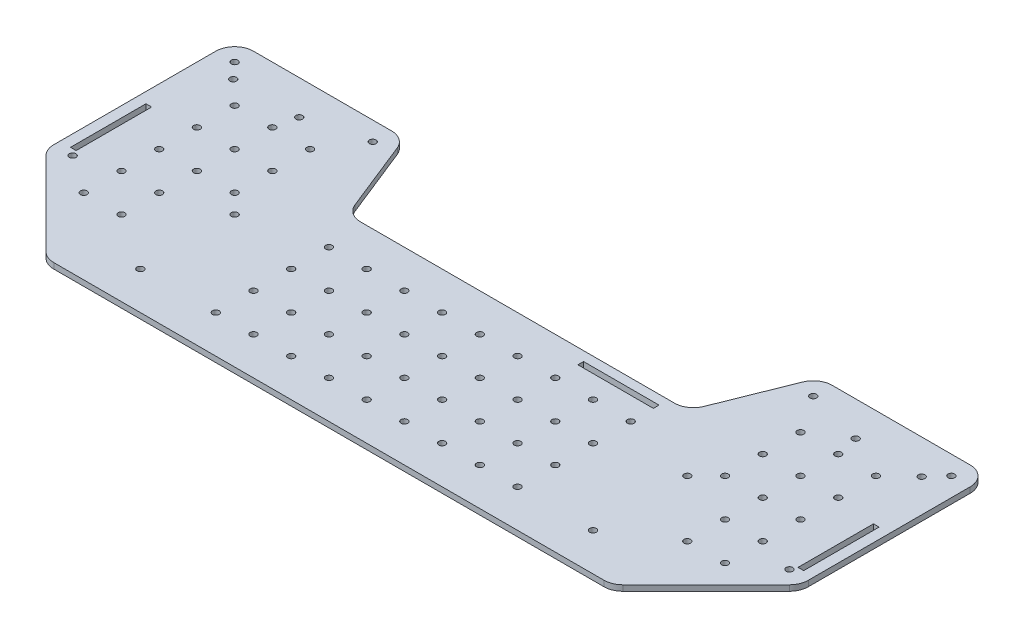
from build123d import *

# Parameters (mm, degrees)
EXTRUDE_1_DEPTH     = 3
SKETCH_2_R          = 1.75
CUT_EXTRUDE_1_DEPTH = 59
SKETCH_3_R          = 1.75
CUT_EXTRUDE_2_DEPTH = 59
SKETCH_5_R          = 1.75
CUT_EXTRUDE_4_DEPTH = 10
SKETCH_6_R          = 1.75
CUT_EXTRUDE_5_DEPTH = 10
SKETCH_7_R          = 1.75
CUT_EXTRUDE_6_DEPTH = 10
SKETCH_4_R          = 1.75
CUT_EXTRUDE_3_DEPTH = 59
SKETCH_8_W          = 3
SKETCH_8_H          = 40
CUT_EXTRUDE_7_DEPTH = 3
SKETCH_9_W          = 40
SKETCH_9_H          = 3
CUT_EXTRUDE_8_DEPTH = 4


with BuildPart() as part:
    # 草图1 → 凸台-拉伸1 (new body)
    with BuildSketch(Plane(origin=(0, 0, 0), x_dir=(1, 0, 0), z_dir=(0, 1, 0))):
        with BuildLine():
            Line((-197.071067812, -27.928932188), (-152.928932188, -72.071067812))
            ThreePointArc((-152.928932188, -72.071067812), (-149.6846987, -74.238795325), (-145.857864376, -75))
            Line((-145.857864376, -75), (145.857864376, -75))
            ThreePointArc((145.857864376, -75), (149.6846987, -74.238795325), (152.928932188, -72.071067812))
            Line((152.928932188, -72.071067812), (197.071067812, -27.928932188))
            ThreePointArc((197.071067812, -27.928932188), (199.238795325, -24.6846987), (200, -20.857864376))
            Line((200, -20.857864376), (200, 65))
            ThreePointArc((200, 65), (197.071067812, 72.071067812), (190, 75))
            Line((190, 75), (116.770329614, 75))
            ThreePointArc((116.770329614, 75), (111.164041521, 73.280672305), (107.485562705, 68.713906764))
            Line((107.485562705, 68.713906764), (92.514437295, 31.286093236))
            ThreePointArc((92.514437295, 31.286093236), (88.835958479, 26.719327695), (83.229670386, 25))
            Line((83.229670386, 25), (-83.229670386, 25))
            ThreePointArc((-83.229670386, 25), (-88.835958479, 26.719327695), (-92.514437295, 31.286093236))
            Line((-92.514437295, 31.286093236), (-107.485562705, 68.713906764))
            ThreePointArc((-107.485562705, 68.713906764), (-111.164041521, 73.280672305), (-116.770329614, 75))
            Line((-116.770329614, 75), (-190, 75))
            ThreePointArc((-190, 75), (-197.071067812, 72.071067812), (-200, 65))
            Line((-200, 65), (-200, -20.857864376))
            ThreePointArc((-200, -20.857864376), (-199.238795325, -24.6846987), (-197.071067812, -27.928932188))
        make_face()
    extrude(amount=EXTRUDE_1_DEPTH)

    # 草图2 → 切除-拉伸1 (cut)
    with BuildSketch(Plane.XZ):
        with Locations((120, 5)):
            Circle(SKETCH_2_R)
        with Locations((120, 55)):
            Circle(SKETCH_2_R)
        with Locations((-120, 55)):
            Circle(SKETCH_2_R)
        with Locations((-120, 5)):
            Circle(SKETCH_2_R)
    extrude(amount=-CUT_EXTRUDE_1_DEPTH, mode=Mode.SUBTRACT)

    # 草图3 → 切除-拉伸2 (cut)
    with BuildSketch(Plane(origin=(0, 3, 0), x_dir=(1, 0, 0), z_dir=(0, 1, 0))):
        with Locations((116.770329614, 65)):
            Circle(SKETCH_3_R)
        with Locations((190, 65)):
            Circle(SKETCH_3_R)
        with Locations((-190, 65)):
            Circle(SKETCH_3_R)
        with Locations((-116.770329614, 65)):
            Circle(SKETCH_3_R)
        with Locations((-190, -20.857864376)):
            Circle(SKETCH_3_R)
        with Locations((190, -20.857864376)):
            Circle(SKETCH_3_R)
    extrude(amount=-CUT_EXTRUDE_2_DEPTH, mode=Mode.SUBTRACT)

    # 草图5 → 切除-拉伸4 (cut)
    with BuildSketch(Plane(origin=(0, 3, 0), x_dir=(1, 0, 0), z_dir=(0, 1, 0))):
        with Locations((-20, 5)):
            Circle(SKETCH_5_R)
        with Locations((-20, -15)):
            Circle(SKETCH_5_R)
        with Locations((-20, -35)):
            Circle(SKETCH_5_R)
        with Locations((-20, -55)):
            Circle(SKETCH_5_R)
        with Locations((-40, 5)):
            Circle(SKETCH_5_R)
        with Locations((-40, -15)):
            Circle(SKETCH_5_R)
        with Locations((-40, -35)):
            Circle(SKETCH_5_R)
        with Locations((-40, -55)):
            Circle(SKETCH_5_R)
        with Locations((-60, 5)):
            Circle(SKETCH_5_R)
        with Locations((-60, -15)):
            Circle(SKETCH_5_R)
        with Locations((-60, -35)):
            Circle(SKETCH_5_R)
        with Locations((-60, -55)):
            Circle(SKETCH_5_R)
        with Locations((-80, 5)):
            Circle(SKETCH_5_R)
        with Locations((-80, -15)):
            Circle(SKETCH_5_R)
        with Locations((-80, -35)):
            Circle(SKETCH_5_R)
        with Locations((-80, -55)):
            Circle(SKETCH_5_R)
        with Locations((80, -55)):
            Circle(SKETCH_5_R)
        with Locations((80, -35)):
            Circle(SKETCH_5_R)
        with Locations((80, -15)):
            Circle(SKETCH_5_R)
        with Locations((80, 5)):
            Circle(SKETCH_5_R)
        with Locations((60, -55)):
            Circle(SKETCH_5_R)
        with Locations((60, -35)):
            Circle(SKETCH_5_R)
        with Locations((60, -15)):
            Circle(SKETCH_5_R)
        with Locations((60, 5)):
            Circle(SKETCH_5_R)
        with Locations((40, -55)):
            Circle(SKETCH_5_R)
        with Locations((40, -35)):
            Circle(SKETCH_5_R)
        with Locations((40, -15)):
            Circle(SKETCH_5_R)
        with Locations((40, 5)):
            Circle(SKETCH_5_R)
        with Locations((20, -55)):
            Circle(SKETCH_5_R)
        with Locations((20, -35)):
            Circle(SKETCH_5_R)
        with Locations((20, -15)):
            Circle(SKETCH_5_R)
        with Locations((20, 5)):
            Circle(SKETCH_5_R)
    extrude(amount=-CUT_EXTRUDE_4_DEPTH, mode=Mode.SUBTRACT)

    # 草图6 → 切除-拉伸5 (cut)
    with BuildSketch(Plane(origin=(0, 3, 0), x_dir=(1, 0, 0), z_dir=(0, 1, 0))):
        with Locations((-170, 45)):
            Circle(SKETCH_6_R)
        with Locations((-150, 45)):
            Circle(SKETCH_6_R)
        with Locations((-130, 45)):
            Circle(SKETCH_6_R)
        with Locations((-170, 25)):
            Circle(SKETCH_6_R)
        with Locations((-150, 25)):
            Circle(SKETCH_6_R)
        with Locations((-130, 25)):
            Circle(SKETCH_6_R)
        with Locations((-170, 5)):
            Circle(SKETCH_6_R)
        with Locations((-150, 5)):
            Circle(SKETCH_6_R)
        with Locations((-130, 5)):
            Circle(SKETCH_6_R)
        with Locations((-170, -15)):
            Circle(SKETCH_6_R)
        with Locations((-150, -15)):
            Circle(SKETCH_6_R)
        with Locations((-170, -35)):
            Circle(SKETCH_6_R)
        with Locations((-150, -35)):
            Circle(SKETCH_6_R)
        with Locations((150, -35)):
            Circle(SKETCH_6_R)
        with Locations((170, -35)):
            Circle(SKETCH_6_R)
        with Locations((150, -15)):
            Circle(SKETCH_6_R)
        with Locations((170, -15)):
            Circle(SKETCH_6_R)
        with Locations((130, 5)):
            Circle(SKETCH_6_R)
        with Locations((150, 5)):
            Circle(SKETCH_6_R)
        with Locations((170, 5)):
            Circle(SKETCH_6_R)
        with Locations((130, 25)):
            Circle(SKETCH_6_R)
        with Locations((150, 25)):
            Circle(SKETCH_6_R)
        with Locations((170, 25)):
            Circle(SKETCH_6_R)
        with Locations((130, 45)):
            Circle(SKETCH_6_R)
        with Locations((150, 45)):
            Circle(SKETCH_6_R)
        with Locations((170, 45)):
            Circle(SKETCH_6_R)
    extrude(amount=-CUT_EXTRUDE_5_DEPTH, mode=Mode.SUBTRACT)

    # 草图7 → 切除-拉伸6 (cut)
    with BuildSketch(Plane(origin=(0, 3, 0), x_dir=(1, 0, 0), z_dir=(0, 1, 0))):
        with Locations((0, 5)):
            Circle(SKETCH_7_R)
        with Locations((0, -15)):
            Circle(SKETCH_7_R)
        with Locations((0, -35)):
            Circle(SKETCH_7_R)
        with Locations((0, -55)):
            Circle(SKETCH_7_R)
    extrude(amount=-CUT_EXTRUDE_6_DEPTH, mode=Mode.SUBTRACT)

    # 草图4 → 切除-拉伸3 (cut)
    with BuildSketch(Plane.XZ):
        with Locations((147.5, -56.75)):
            Circle(SKETCH_4_R)
        with Locations((182.5, -56.75)):
            Circle(SKETCH_4_R)
        with Locations((-182.5, -56.75)):
            Circle(SKETCH_4_R)
        with Locations((-147.5, -56.75)):
            Circle(SKETCH_4_R)
    extrude(amount=-CUT_EXTRUDE_3_DEPTH, mode=Mode.SUBTRACT)

    # 草图8 → 切除-拉伸7 (cut)
    with BuildSketch(Plane(origin=(0, 3, 0), x_dir=(1, 0, 0), z_dir=(0, 1, 0))):
        with Locations((192.86, 2.35)):
            Rectangle(SKETCH_8_W, SKETCH_8_H)
        with Locations((-192.86, 2.35)):
            Rectangle(SKETCH_8_W, SKETCH_8_H)
    extrude(amount=-CUT_EXTRUDE_7_DEPTH, mode=Mode.SUBTRACT)

    # 草图9 → 切除-拉伸8 (cut)
    with BuildSketch(Plane(origin=(0, 3, 0), x_dir=(1, 0, 0), z_dir=(0, 1, 0))):
        with Locations((60, 18.5)):
            Rectangle(SKETCH_9_W, SKETCH_9_H)
    extrude(amount=-CUT_EXTRUDE_8_DEPTH, mode=Mode.SUBTRACT)


solid = part.part
